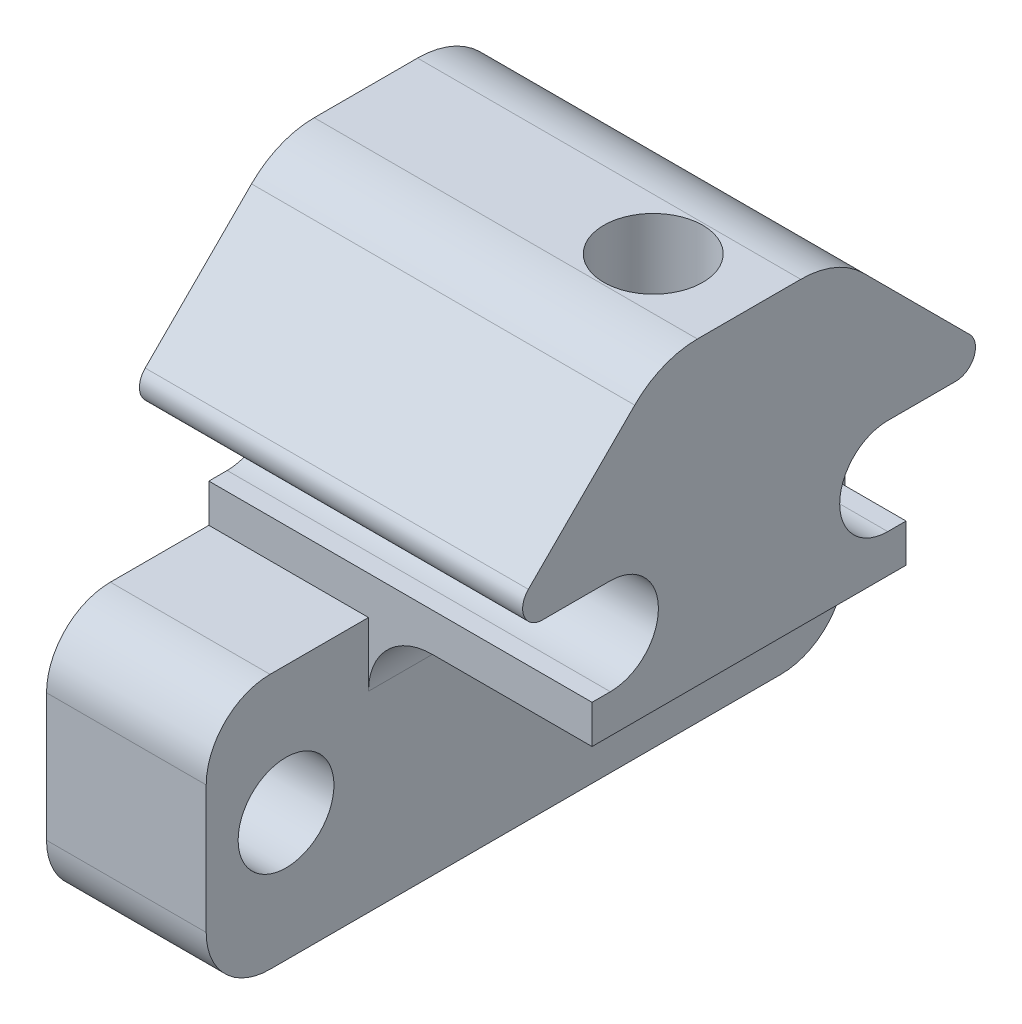
from build123d import *

# Parameters (mm, degrees)
BOSS_EXTRUDE1_DEPTH = 12
SKETCH2_W           = 5
SKETCH2_H           = 20
BOSS_EXTRUDE2_DEPTH = 8
SKETCH3_R           = 1.55
CUT_EXTRUDE1_DEPTH  = 19.232909193
FILLET1_R           = 2
SKETCH5_R           = 1.5
CUT_EXTRUDE2_DEPTH  = 21.133140451


with BuildPart() as part:
    # Sketch1 → Boss-Extrude1 (new body)
    with BuildSketch(Plane(origin=(0, 0, 0), x_dir=(0, 0, -1), z_dir=(1, 0, 0))):
        with BuildLine():
            Line((-4.9170836, -3.5021), (-4.3434, -3.5021))
            ThreePointArc((-4.3434, -3.5021), (-2.8385, -1.9972), (-4.3434, -0.4923))
            Line((-4.3434, -0.4923), (-6.474794456, -0.4923))
            ThreePointArc((-6.474794456, -0.4923), (-7.043904248, -0.112032994), (-6.910372233, 0.559277777))
            Line((-6.910372233, 0.559277777), (-3.580328692, 3.889321318))
            ThreePointArc((-3.580328692, 3.889321318), (-2.680053899, 4.490865703), (-1.618107374, 4.7021))
            Line((-1.618107374, 4.7021), (1.618107374, 4.7021))
            ThreePointArc((1.618107374, 4.7021), (2.680053899, 4.490865703), (3.580328692, 3.889321318))
            Line((3.580328692, 3.889321318), (6.910372233, 0.559277777))
            ThreePointArc((6.910372233, 0.559277777), (7.043904248, -0.112032994), (6.474794456, -0.4923))
            Line((6.474794456, -0.4923), (4.3434, -0.4923))
            ThreePointArc((4.3434, -0.4923), (2.838499971, -1.997200005), (4.34340001, -3.5021))
            Line((4.34340001, -3.5021), (4.9170836, -3.5021))
            Line((4.9170836, -3.5021), (4.9170836, -4.7021))
            Line((4.9170836, -4.7021), (-4.9170836, -4.7021))
            Line((-4.9170836, -4.7021), (-4.9170836, -3.5021))
        make_face()
    extrude(amount=BOSS_EXTRUDE1_DEPTH)

    # Sketch2 → Boss-Extrude2 (add)
    with BuildSketch(Plane.XZ.offset(4.7021)):
        with Locations((2.5, 0)):
            Rectangle(SKETCH2_W, SKETCH2_H)
    extrude(amount=BOSS_EXTRUDE2_DEPTH)

    # Sketch3 → Cut-Extrude1 (cut, through all)
    with BuildSketch(Plane.XZ.offset(4.7021)):
        with Locations((9, 0)):
            Circle(SKETCH3_R)
    extrude(amount=-CUT_EXTRUDE1_DEPTH, mode=Mode.SUBTRACT)

    # Fillet1
    fillet1_edges = [part.edges().sort_by_distance(p)[0] for p in [
        (5, -4.7021, 0),
        (2.5, -4.7021, 10),
        (2.5, -12.7021, 10),
        (2.5, -12.7021, -10),
        (2.5, -4.7021, -10),
    ]]
    fillet(fillet1_edges, radius=FILLET1_R)

    # Sketch5 → Cut-Extrude2 (cut, through all)
    with BuildSketch(Plane.ZY):
        with Locations((-7.5, -8.7021)):
            Circle(SKETCH5_R)
        with Locations((7.5, -8.7021)):
            Circle(SKETCH5_R)
    extrude(amount=-CUT_EXTRUDE2_DEPTH, mode=Mode.SUBTRACT)


solid = part.part
